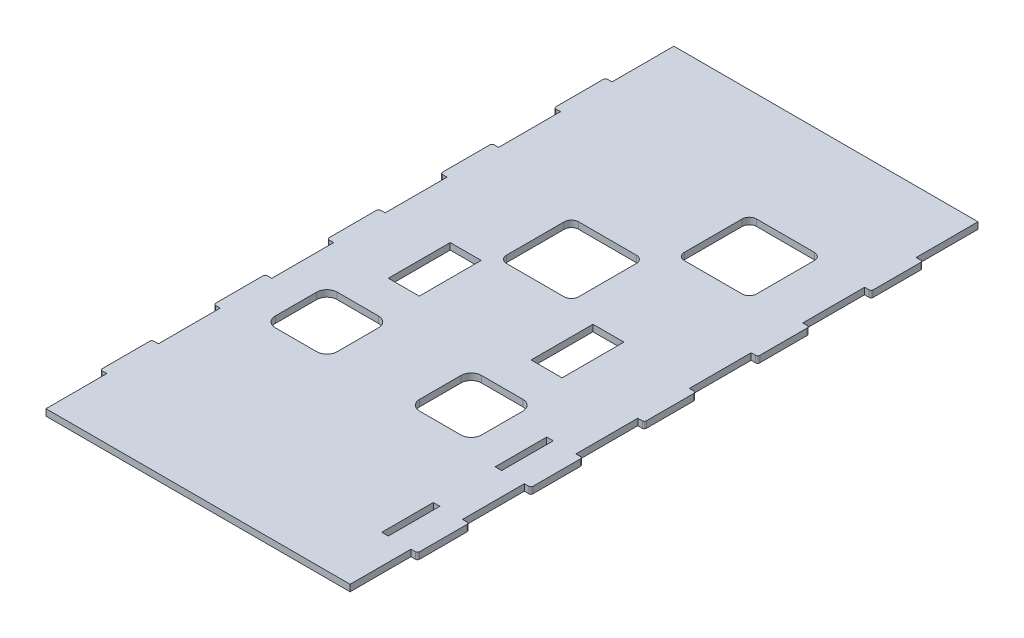
from build123d import *

# Parameters (mm, degrees)
BOSS_EXTRUDE1_DEPTH = 6.35
FILLET1_R           = 2
SKETCH2_W           = 6.35
SKETCH2_H           = 50
SKETCH2_W_2         = 30
SKETCH2_H_2         = 60
CUT_EXTRUDE1_DEPTH  = 6.35


with BuildPart() as part:
    # Sketch1 → Boss-Extrude1 (new body)
    with BuildSketch(Plane(origin=(0, 0, 0), x_dir=(1, 0, 0), z_dir=(0, 1, 0))):
        Polygon((0, 0), (295, 0), (295, 59), (301.35, 59), (301.35, 109), (295, 109), (295, 169), (301.35, 169), (301.35, 219), (295, 219), (295, 279), (301.35, 279), (301.35, 329), (295, 329), (295, 389), (301.35, 389), (301.35, 439), (295, 439), (295, 499), (301.35, 499), (301.35, 549), (295, 549), (295, 609), (0, 609), (0, 549), (-6.35, 549), (-6.35, 499), (0, 499), (0, 439), (-6.35, 439), (-6.35, 389), (0, 389), (0, 329), (-6.35, 329), (-6.35, 279), (0, 279), (0, 219), (-6.35, 219), (-6.35, 169), (0, 169), (0, 109), (-6.35, 109), (-6.35, 59), (0, 59), align=None)
    extrude(amount=BOSS_EXTRUDE1_DEPTH)

    # Fillet1
    fillet1_edges = [part.edges().sort_by_distance(p)[0] for p in [
        (301.35, 3.175, -549),
        (301.35, 3.175, -499),
        (301.35, 3.175, -439),
        (301.35, 3.175, -389),
        (301.35, 3.175, -329),
        (301.35, 3.175, -279),
        (301.35, 3.175, -219),
        (301.35, 3.175, -169),
        (301.35, 3.175, -109),
        (301.35, 3.175, -59),
        (-6.35, 3.175, -59),
        (-6.35, 3.175, -109),
        (-6.35, 3.175, -169),
        (-6.35, 3.175, -219),
        (-6.35, 3.175, -279),
        (-6.35, 3.175, -329),
        (-6.35, 3.175, -389),
        (-6.35, 3.175, -439),
        (-6.35, 3.175, -499),
        (-6.35, 3.175, -549),
    ]]
    fillet(fillet1_edges, radius=FILLET1_R)

    # Sketch2 → Cut-Extrude1 (cut)
    with BuildSketch(Plane(origin=(0, 6.35, 0), x_dir=(1, 0, 0), z_dir=(0, 1, 0))):
        with Locations((269.825, 194)):
            Rectangle(SKETCH2_W, SKETCH2_H)
        with Locations((269.825, 84)):
            Rectangle(SKETCH2_W, SKETCH2_H)
        with BuildLine():
            Line((101.348136113, 415.272362228), (157.348136113, 415.272362228))
            ThreePointArc((157.348136113, 415.272362228), (162.297883581, 413.222109696), (164.348136113, 408.272362228))
            Line((164.348136113, 408.272362228), (164.348136113, 352.272362228))
            ThreePointArc((164.348136113, 352.272362228), (162.297883581, 347.322614759), (157.348136113, 345.272362228))
            Line((157.348136113, 345.272362228), (101.348136113, 345.272362228))
            ThreePointArc((101.348136113, 345.272362228), (96.398388645, 347.322614759), (94.348136113, 352.272362228))
            Line((94.348136113, 352.272362228), (94.348136113, 408.272362228))
            ThreePointArc((94.348136113, 408.272362228), (96.398388645, 413.222109696), (101.348136113, 415.272362228))
        make_face()
        with BuildLine():
            Line((185.233522799, 503.969461472), (241.233522799, 503.969461472))
            ThreePointArc((241.233522799, 503.969461472), (246.183270267, 501.91920894), (248.233522799, 496.969461472))
            Line((248.233522799, 496.969461472), (248.233522799, 440.969461472))
            ThreePointArc((248.233522799, 440.969461472), (246.183270267, 436.019714004), (241.233522799, 433.969461472))
            Line((241.233522799, 433.969461472), (185.233522799, 433.969461472))
            ThreePointArc((185.233522799, 433.969461472), (180.283775331, 436.019714004), (178.233522799, 440.969461472))
            Line((178.233522799, 440.969461472), (178.233522799, 496.969461472))
            ThreePointArc((178.233522799, 496.969461472), (180.283775331, 501.91920894), (185.233522799, 503.969461472))
        make_face()
        with BuildLine():
            Line((43.325, 239.143159068), (83.325, 239.143159068))
            ThreePointArc((83.325, 239.143159068), (90.396067812, 236.21422688), (93.325, 229.143159068))
            Line((93.325, 229.143159068), (93.325, 189.143159068))
            ThreePointArc((93.325, 189.143159068), (90.396067812, 182.072091256), (83.325, 179.143159068))
            Line((83.325, 179.143159068), (43.325, 179.143159068))
            ThreePointArc((43.325, 179.143159068), (36.253932188, 182.072091256), (33.325, 189.143159068))
            Line((33.325, 189.143159068), (33.325, 229.143159068))
            ThreePointArc((33.325, 229.143159068), (36.253932188, 236.21422688), (43.325, 239.143159068))
        make_face()
        with Locations((71.473965374, 305.574146312)):
            Rectangle(SKETCH2_W_2, SKETCH2_H_2)
        with Locations((209.35573951, 306.193400943)):
            Rectangle(SKETCH2_W_2, SKETCH2_H_2)
        with BuildLine():
            Line((173.325, 229.143159068), (173.325, 189.143159068))
            ThreePointArc((173.325, 189.143159068), (176.253932188, 182.072091256), (183.325, 179.143159068))
            Line((183.325, 179.143159068), (223.325, 179.143159068))
            ThreePointArc((223.325, 179.143159068), (230.396067812, 182.072091256), (233.325, 189.143159068))
            Line((233.325, 189.143159068), (233.325, 229.143159068))
            ThreePointArc((233.325, 229.143159068), (230.396067812, 236.21422688), (223.325, 239.143159068))
            Line((223.325, 239.143159068), (183.325, 239.143159068))
            ThreePointArc((183.325, 239.143159068), (176.253932188, 236.21422688), (173.325, 229.143159068))
        make_face()
    extrude(amount=-CUT_EXTRUDE1_DEPTH, mode=Mode.SUBTRACT)


solid = part.part
